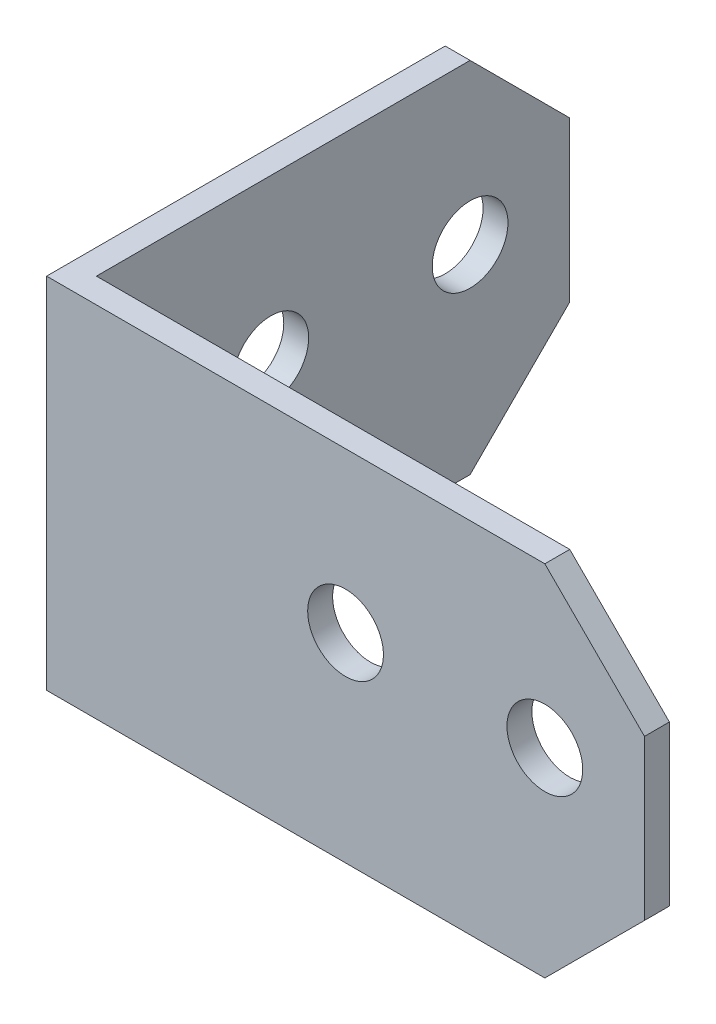
from build123d import *

# Parameters (mm, degrees)
BOSS_EXTRUDE1_DEPTH = 45.72
SKETCH2_R           = 2.413
CUT_EXTRUDE1_DEPTH  = 59.307156693
SKETCH3_R           = 2.413
CUT_EXTRUDE2_DEPTH  = 64.762509842
CHAMFER1_SIZE       = 6.35
CUT_EXTRUDE3_DEPTH  = 59.307156693
CUT_EXTRUDE4_DEPTH  = 64.762509842
SKETCH6_W           = 1.5875
SKETCH6_H           = 22.86
CUT_EXTRUDE5_DEPTH  = 60.143982072
CHAMFER2_SIZE       = 6.35


with BuildPart() as part:
    # Sketch1 → Boss-Extrude1 (new body)
    with BuildSketch(Plane(origin=(0, 0, 0), x_dir=(1, 0, 0), z_dir=(0, 1, 0))):
        Polygon((-18.109259259, 25.341203704), (-16.521759259, 25.341203704), (-16.521759259, -4.821296296), (19.990740741, -4.821296296), (19.990740741, -6.408796296), (-18.109259259, -6.408796296), align=None)
    extrude(amount=BOSS_EXTRUDE1_DEPTH)

    # Sketch2 → Cut-Extrude1 (cut, through all)
    with BuildSketch(Plane(origin=(0, 0, 4.821296296), x_dir=(-1, 0, 0), z_dir=(0, 0, -1))):
        with Locations((-0.940740741, 35.56)):
            Circle(SKETCH2_R)
        with Locations((-13.640740741, 35.56)):
            Circle(SKETCH2_R)
        with Locations((-13.640740741, 10.16)):
            Circle(SKETCH2_R)
        with Locations((-0.940740741, 10.16)):
            Circle(SKETCH2_R)
    extrude(amount=-CUT_EXTRUDE1_DEPTH, mode=Mode.SUBTRACT)

    # Sketch3 → Cut-Extrude2 (cut, through all)
    with BuildSketch(Plane(origin=(-16.521759259, 0, 0), x_dir=(0, 0, -1), z_dir=(1, 0, 0))):
        with Locations((6.291203704, 35.56)):
            Circle(SKETCH3_R)
        with Locations((18.991203704, 35.56)):
            Circle(SKETCH3_R)
        with Locations((18.991203704, 10.16)):
            Circle(SKETCH3_R)
        with Locations((6.291203704, 10.16)):
            Circle(SKETCH3_R)
    extrude(amount=-CUT_EXTRUDE2_DEPTH, mode=Mode.SUBTRACT)

    # Chamfer1
    chamfer1_edges = [part.edges().sort_by_distance(p)[0] for p in [
        (19.990740741, 45.72, 5.615046296),
        (19.990740741, 0, 5.615046296),
        (-17.315509259, 0, -25.341203704),
        (-17.315509259, 45.72, -25.341203704),
    ]]
    chamfer(chamfer1_edges, length=CHAMFER1_SIZE)

    # Sketch4 → Cut-Extrude3 (cut, through all)
    with BuildSketch(Plane(origin=(0, 0, 4.821296296), x_dir=(-1, 0, 0), z_dir=(0, 0, -1))):
        Polygon((-19.990740741, 22.86), (16.521759259, 22.86), (16.521759259, 0), (-13.640740741, 0), (-19.990740741, 6.35), align=None)
    extrude(amount=-CUT_EXTRUDE3_DEPTH, mode=Mode.SUBTRACT)

    # Sketch5 → Cut-Extrude4 (cut, through all)
    with BuildSketch(Plane(origin=(-16.521759259, 0, 0), x_dir=(0, 0, -1), z_dir=(1, 0, 0))):
        Polygon((25.341203704, 22.86), (-4.821296296, 22.86), (-4.821296296, 0), (18.991203704, 0), (25.341203704, 6.35), align=None)
    extrude(amount=-CUT_EXTRUDE4_DEPTH, mode=Mode.SUBTRACT)

    # Sketch6 → Cut-Extrude5 (cut, through all)
    with BuildSketch(Plane.XY.offset(6.408796296)):
        with Locations((-17.315509259, 11.43)):
            Rectangle(SKETCH6_W, SKETCH6_H)
    extrude(amount=-CUT_EXTRUDE5_DEPTH, mode=Mode.SUBTRACT)

    # Chamfer2
    chamfer2_edges = [part.edges().sort_by_distance(p)[0] for p in [
        (-17.315509259, 22.86, -25.341203704),
        (19.990740741, 22.86, 5.615046296),
    ]]
    chamfer(chamfer2_edges, length=CHAMFER2_SIZE)


solid = part.part
